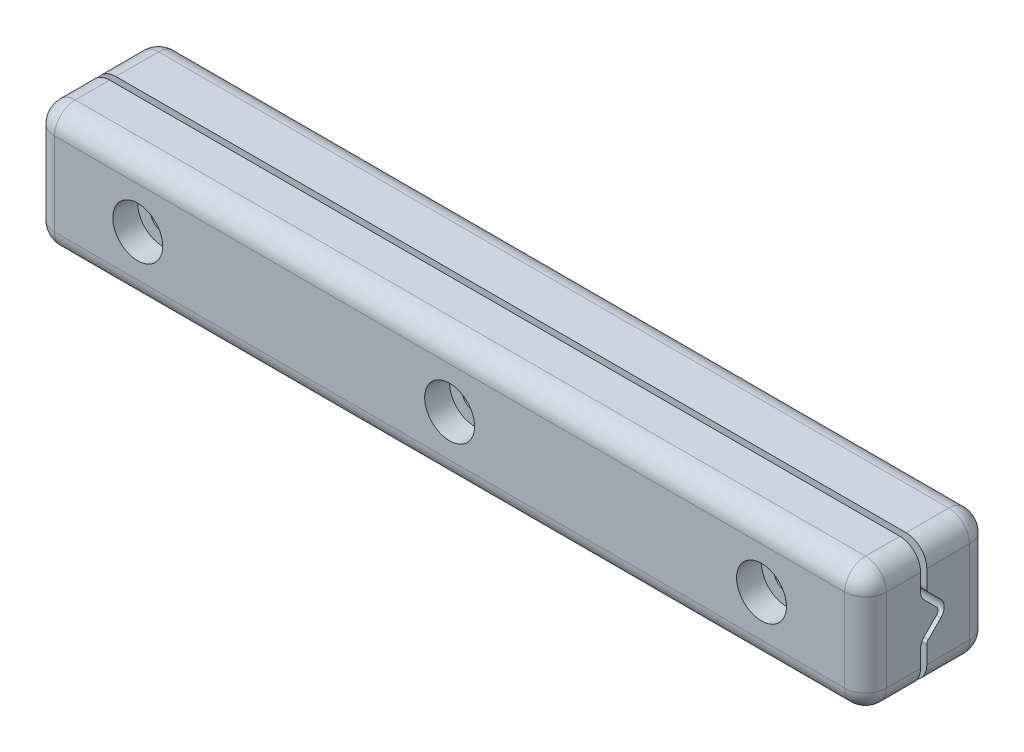
from build123d import *

# Parameters (mm, degrees)
SKETCH_1_W          = 200
SKETCH_1_H          = 30
EXTRUDE_1_DEPTH     = 15
FILLET_1_R          = 5
CUT_EXTRUDE_8_DEPTH = 202.198906558
SKETCH_4_R          = 3
CUT_EXTRUDE_4_DEPTH = 106.475115549
SKETCH_7_R          = 6
CUT_EXTRUDE_5_DEPTH = 6
SKETCH_8_R          = 6
CUT_EXTRUDE_6_DEPTH = 6


with BuildPart() as part:
    # Эскиз1 → Бобышка-Вытянуть1 (new, symmetric)
    with BuildSketch(Plane.XY.offset(-1)):
        Rectangle(SKETCH_1_W, SKETCH_1_H)
    extrude(amount=EXTRUDE_1_DEPTH, both=True)

    # Скругление1
    fillet_1_edges = [part.edges().sort_by_distance(p)[0] for p in [
        (0, -15, -16),
        (-100, -15, -1),
        (-100, 0, -16),
        (100, -15, -1),
        (100, 0, -16),
        (0, -15, 14),
        (-100, 0, 14),
        (100, 0, 14),
        (100, 15, -1),
        (0, 15, 14),
        (-100, 15, -1),
        (0, 15, -16),
    ]]
    fillet(fillet_1_edges, radius=FILLET_1_R)

    # Эскиз3 → Вырез-Вытянуть8 (cut, through all)
    with BuildSketch(Plane(origin=(100, 0, 0), x_dir=(0, 0, -1), z_dir=(1, 0, 0))):
        with BuildLine():
            Line((0.055456352, 3.883883476), (3.055456352, 0.883883476))
            ThreePointArc((3.055456352, 0.883883476), (3.421572875, 0), (3.055456352, -0.883883476))
            Line((3.055456352, -0.883883476), (0.055456352, -3.883883476))
            ThreePointArc((0.055456352, -3.883883476), (-0.540668714, -4.776047686), (-0.75, -5.828427125))
            Line((-0.75, -5.828427125), (-0.75, -19.290089193))
            Line((-0.75, -19.290089193), (0.75, -19.290089193))
            Line((0.75, -19.290089193), (0.75, -5.828427125))
            ThreePointArc((0.75, -5.828427125), (0.845150584, -5.350072834), (1.116116524, -4.944543648))
            Line((1.116116524, -4.944543648), (4.116116524, -1.944543648))
            ThreePointArc((4.116116524, -1.944543648), (4.921572875, 0), (4.116116524, 1.944543648))
            Line((4.116116524, 1.944543648), (1.116116524, 4.944543648))
            ThreePointArc((1.116116524, 4.944543648), (0.845150584, 5.350072834), (0.75, 5.828427125))
            Line((0.75, 5.828427125), (0.75, 19.774069925))
            Line((0.75, 19.774069925), (-0.75, 19.774069925))
            Line((-0.75, 19.774069925), (-0.75, 5.828427125))
            ThreePointArc((-0.75, 5.828427125), (-0.540668714, 4.776047686), (0.055456352, 3.883883476))
        make_face()
    extrude(amount=-CUT_EXTRUDE_8_DEPTH, mode=Mode.SUBTRACT)


with BuildPart() as cut_extrude_8_piece_1:
    # of the separate pieces the step leaves, piece 1, a body of its own (cut_extrude_8_pieces)
    add(part.part.solids().sort_by_distance((-95, -15, -0.75))[0])


with BuildPart() as cut_extrude_8_piece_2:
    # of the separate pieces the step leaves, piece 2, a body of its own (cut_extrude_8_pieces)
    add(part.part.solids().sort_by_distance((-95, -15, 9))[0])


with BuildPart() as cut_extrude_4_tool:
    # Эскиз4 → Вырез-Вытянуть4 (new, through all)
    with BuildSketch(Plane.XY.offset(14)):
        Circle(SKETCH_4_R)
        with Locations((-75, 0)):
            Circle(SKETCH_4_R)
        with Locations((75, 0)):
            Circle(SKETCH_4_R)
    extrude(amount=-CUT_EXTRUDE_4_DEPTH)


with BuildPart() as cut_extrude_8_piece_1_1:
    add(cut_extrude_8_piece_1.part)

    # Вырез-Вытянуть4: cut by cut_extrude_4_tool
    add(cut_extrude_4_tool.part, mode=Mode.SUBTRACT)

    # Эскиз8 → Вырез-Вытянуть6 (cut)
    with BuildSketch(Plane(origin=(0, 0, -16), x_dir=(-1, 0, 0), z_dir=(0, 0, -1))):
        with Locations((75, 0)):
            Circle(SKETCH_8_R)
        Circle(SKETCH_8_R)
        with Locations((-75, 0)):
            Circle(SKETCH_8_R)
    extrude(amount=-CUT_EXTRUDE_6_DEPTH, mode=Mode.SUBTRACT)


with BuildPart() as cut_extrude_8_piece_2_1:
    add(cut_extrude_8_piece_2.part)

    # Вырез-Вытянуть4: cut by cut_extrude_4_tool
    add(cut_extrude_4_tool.part, mode=Mode.SUBTRACT)

    # Эскиз7 → Вырез-Вытянуть5 (cut)
    with BuildSketch(Plane.XY.offset(14)):
        with Locations((-75, 0)):
            Circle(SKETCH_7_R)
        Circle(SKETCH_7_R)
        with Locations((75, 0)):
            Circle(SKETCH_7_R)
    extrude(amount=-CUT_EXTRUDE_5_DEPTH, mode=Mode.SUBTRACT)


solid = Compound([cut_extrude_8_piece_1_1.part, cut_extrude_8_piece_2_1.part])
